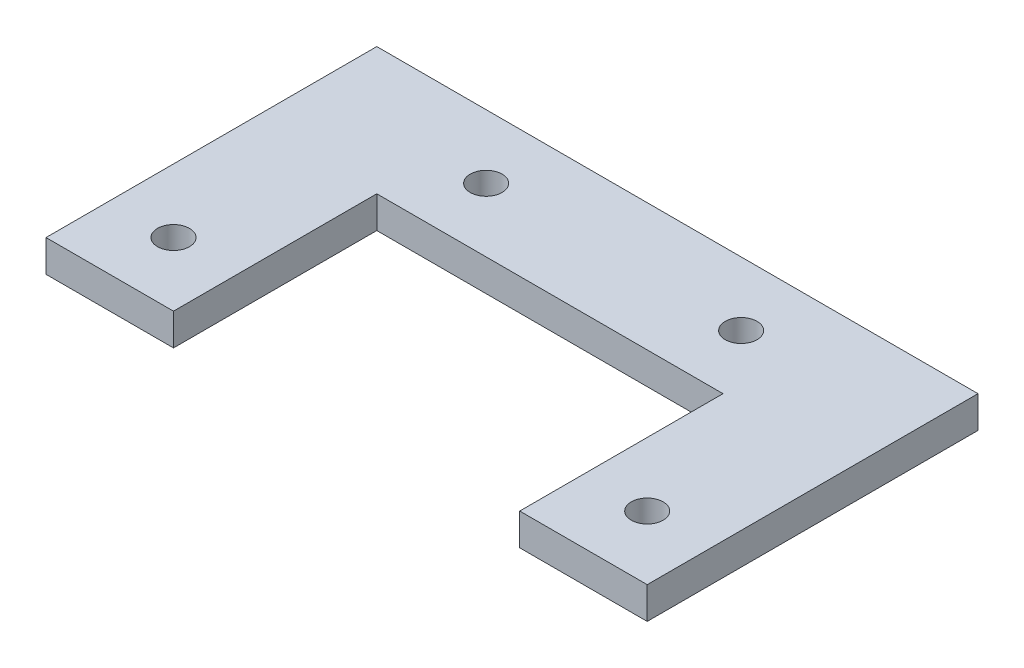
from build123d import *

# Parameters (mm, degrees)
SKETCH1_R           = 1.5875
BOSS_EXTRUDE1_DEPTH = 3.175


with BuildPart() as part:
    # Sketch1 → Boss-Extrude1 (new body)
    with BuildSketch(Plane(origin=(0, 0, 0), x_dir=(1, 0, 0), z_dir=(0, 1, 0))):
        Polygon((29.94375, 12.7), (-29.94375, 12.7), (-29.94375, -20.25078125), (-17.24375, -20.25078125), (-17.24375, 0), (17.24375, 0), (17.24375, -20.25078125), (29.94375, -20.25078125), align=None)
        with Locations((-23.59375, -13.90078125)):
            Circle(SKETCH1_R, mode=Mode.SUBTRACT)
        with Locations((23.59375, -13.90078125)):
            Circle(SKETCH1_R, mode=Mode.SUBTRACT)
        with Locations((-12.7, 6.35)):
            Circle(SKETCH1_R, mode=Mode.SUBTRACT)
        with Locations((12.7, 6.35)):
            Circle(SKETCH1_R, mode=Mode.SUBTRACT)
    extrude(amount=BOSS_EXTRUDE1_DEPTH)


solid = part.part
